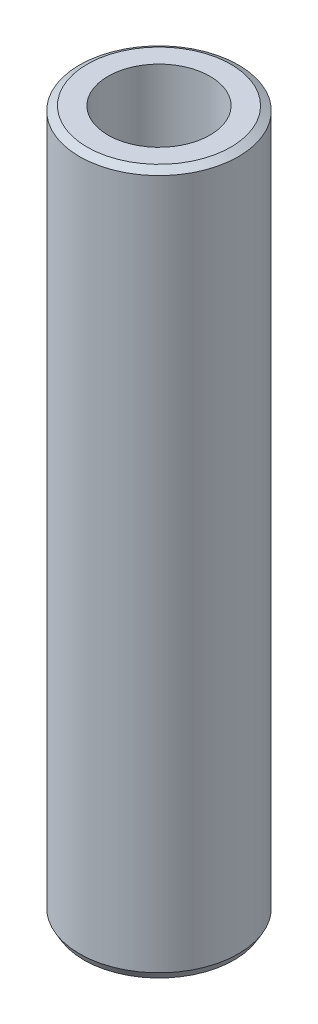
from build123d import *
from OCP.BRepFilletAPI import BRepFilletAPI_MakeChamfer

# Parameters (mm, degrees)
SKETCH1_R           = 45
BOSS_EXTRUDE1_DEPTH = 397.805296062
SKETCH2_R           = 28.887173225
CUT_EXTRUDE1_DEPTH  = 403.863566949
CHAMFER1_SIZE       = 2.489241523
CHAMFER1_SIZE2      = 4.311492791


with BuildPart() as part:
    # Sketch1 → Boss-Extrude1 (new body)
    with BuildSketch(Plane(origin=(0, 0, 0), x_dir=(1, 0, 0), z_dir=(0, 1, 0))):
        Circle(SKETCH1_R)
    extrude(amount=BOSS_EXTRUDE1_DEPTH)

    # Sketch2 → Cut-Extrude1 (cut, through all)
    with BuildSketch(Plane(origin=(0, 0, 0), x_dir=(1, 0, 0), z_dir=(0, 1, 0))):
        Circle(SKETCH2_R)
    extrude(amount=CUT_EXTRUDE1_DEPTH, mode=Mode.SUBTRACT)

    # Chamfer1: one chamfer whose edges measure the first distance from different faces: ONE call of the kernel's chamfer builder (chamfer() names one face for all edges)
    chamfer1_edges_1 = [part.edges().sort_by_distance(p)[0] for p in [
        (-45, 397.805296062, 0),
    ]]
    chamfer1_side_1 = [part.faces().sort_by_distance(p)[0] for p in [
        (-45, 198.902648031, 0),
    ]]
    chamfer1_edges_2 = [part.edges().sort_by_distance(p)[0] for p in [
        (-45, 0, 0),
    ]]
    chamfer1_side_2 = [part.faces().sort_by_distance(p)[0] for p in [
        (-43.727207794, 0, 0),
    ]]
    chamfer1 = BRepFilletAPI_MakeChamfer(part.part.solid().wrapped)
    for e in chamfer1_edges_1:
        chamfer1.Add(CHAMFER1_SIZE, CHAMFER1_SIZE2, e.wrapped, chamfer1_side_1[0].wrapped)  # the first distance lies on this face
    for e in chamfer1_edges_2:
        chamfer1.Add(CHAMFER1_SIZE, CHAMFER1_SIZE2, e.wrapped, chamfer1_side_2[0].wrapped)  # the first distance lies on this face
    add(Compound.cast(chamfer1.Shape()), mode=Mode.REPLACE)


solid = part.part
